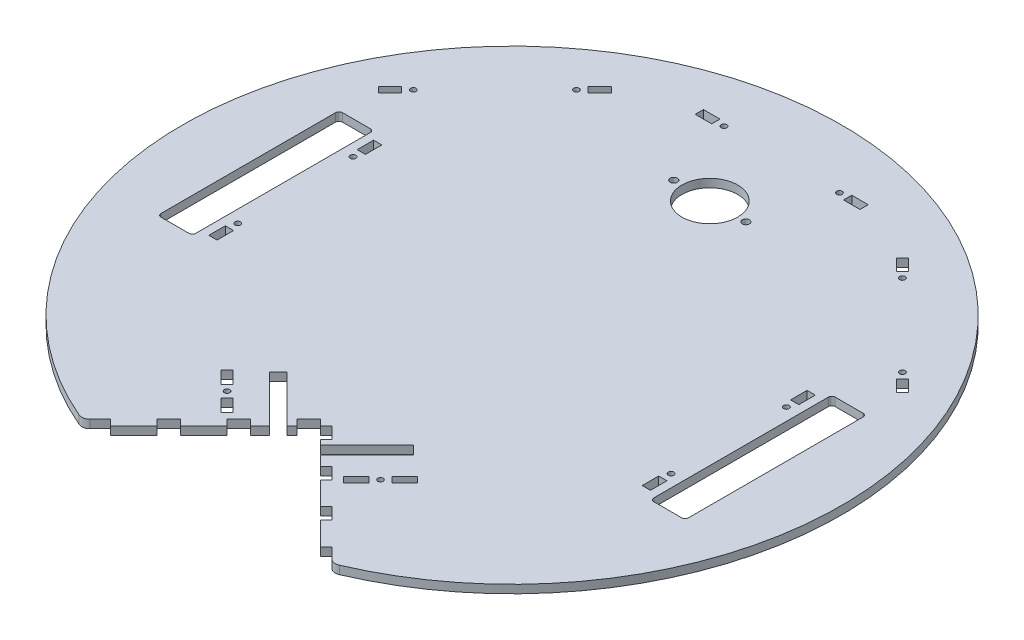
from build123d import *

# Parameters (mm, degrees)
SKETCH1_R           = 254
BOSS_EXTRUDE1_DEPTH = 6.35
CUT_EXTRUDE2_DEPTH  = 360.266367059
CUT_EXTRUDE4_DEPTH  = 360.266367059
SKETCH6_R           = 2.0955
CUT_EXTRUDE6_DEPTH  = 360.266367059
SKETCH8_R           = 2.1336
SKETCH8_W           = 6.35
SKETCH8_H           = 12.7
CUT_EXTRUDE7_DEPTH  = 360.266367059
SKETCH9_R           = 2.1336
SKETCH9_W           = 12.7
SKETCH9_H           = 6.35
CUT_EXTRUDE8_DEPTH  = 360.266367059
SKETCH10_R          = 2.1336
CUT_EXTRUDE9_DEPTH  = 360.266367059
SKETCH11_R          = 21.463
SKETCH11_R_2        = 2.778125
CUT_EXTRUDE10_DEPTH = 360.266367059
SKETCH12_W          = 25.4
SKETCH12_H          = 6.35
SKETCH12_W_2        = 12.7
CUT_EXTRUDE11_DEPTH = 6.35
FILLET1_R           = 6.35
CUT_EXTRUDE12_DEPTH = 360.266367059


with BuildPart() as part:
    # Sketch1 → Boss-Extrude1 (new body)
    with BuildSketch(Plane(origin=(0, 0, 0), x_dir=(1, 0, 0), z_dir=(0, 1, 0))):
        Circle(SKETCH1_R)
    extrude(amount=BOSS_EXTRUDE1_DEPTH)

    # Sketch2 → Cut-Extrude2 (cut, through all)
    with BuildSketch(Plane(origin=(0, 6.35, 0), x_dir=(1, 0, 0), z_dir=(0, 1, 0))):
        with BuildLine():
            Line((0, -147.792682849), (-89.802561211, -237.59524406))
            ThreePointArc((-89.802561211, -237.59524406), (0, -254), (89.802561211, -237.59524406))
            Line((89.802561211, -237.59524406), (0, -147.792682849))
        make_face()
    extrude(amount=-CUT_EXTRUDE2_DEPTH, mode=Mode.SUBTRACT)

    # Sketch4 → Cut-Extrude4 (cut, through all)
    with BuildSketch(Plane(origin=(0, 6.35, 0), x_dir=(1, 0, 0), z_dir=(0, 1, 0))):
        with BuildLine():
            Line((-200.66, 69.85), (-179.07, 69.85))
            ThreePointArc((-179.07, 69.85), (-177.273948776, 69.106051224), (-176.53, 67.31))
            Line((-176.53, 67.31), (-176.53, -67.31))
            ThreePointArc((-176.53, -67.31), (-177.273948776, -69.106051224), (-179.07, -69.85))
            Line((-179.07, -69.85), (-200.66, -69.85))
            ThreePointArc((-200.66, -69.85), (-202.456051224, -69.106051224), (-203.2, -67.31))
            Line((-203.2, -67.31), (-203.2, 67.31))
            ThreePointArc((-203.2, 67.31), (-202.456051224, 69.106051224), (-200.66, 69.85))
        make_face()
    cut_extrude4 = extrude(amount=-CUT_EXTRUDE4_DEPTH, mode=Mode.SUBTRACT)

    # Mirror2: Cut-Extrude4 across plane
    add(cut_extrude4.mirror(Plane(origin=(0, 0, 0), x_dir=(0, 0, 1), z_dir=(1, 0, 0))), mode=Mode.SUBTRACT)

    # Sketch6 → Cut-Extrude6 (cut, through all)
    with BuildSketch(Plane(origin=(0, 6.35, 0), x_dir=(1, 0, 0), z_dir=(0, 1, 0))):
        with Locations((-59.123400668, -160.51133115)):
            Circle(SKETCH6_R)
        Polygon((-61.368464698, -153.77613906), (-71.1004567, -144.044147058), (-75.59058476, -148.534275118), (-65.858592758, -158.26626712), align=None)
        Polygon((-52.388208577, -162.756395181), (-42.656216575, -172.488387182), (-47.146344636, -176.978515243), (-56.878336637, -167.246523241), align=None)
    cut_extrude6 = extrude(amount=-CUT_EXTRUDE6_DEPTH, mode=Mode.SUBTRACT)

    # Mirror5: Cut-Extrude6 across plane
    add(cut_extrude6.mirror(Plane(origin=(0, 0, 0), x_dir=(0, 0, 1), z_dir=(1, 0, 0))), mode=Mode.SUBTRACT)

    # Sketch8 → Cut-Extrude7 (cut, through all)
    with BuildSketch(Plane.XZ):
        with Locations((-167.005, -44.45)):
            Circle(SKETCH8_R)
        with Locations((-167.005, 44.45)):
            Circle(SKETCH8_R)
        with Locations((-167.005, -57.15)):
            Rectangle(SKETCH8_W, SKETCH8_H)
        with Locations((-167.005, 57.15)):
            Rectangle(SKETCH8_W, SKETCH8_H)
    cut_extrude7 = extrude(amount=-CUT_EXTRUDE7_DEPTH, mode=Mode.SUBTRACT)

    # Mirror6: Cut-Extrude7 across plane
    add(cut_extrude7.mirror(Plane(origin=(0, 0, 0), x_dir=(0, 0, 1), z_dir=(1, 0, 0))), mode=Mode.SUBTRACT)

    # Sketch9 → Cut-Extrude8 (cut, through all)
    with BuildSketch(Plane.XZ):
        with Locations((-44.45, -207.81727558)):
            Circle(SKETCH9_R)
        with Locations((44.45, -207.81727558)):
            Circle(SKETCH9_R)
        with Locations((-57.15, -207.81727558)):
            Rectangle(SKETCH9_W, SKETCH9_H)
        with Locations((57.15, -207.81727558)):
            Rectangle(SKETCH9_W, SKETCH9_H)
    extrude(amount=-CUT_EXTRUDE8_DEPTH, mode=Mode.SUBTRACT)

    # Sketch10 → Cut-Extrude9 (cut, through all)
    with BuildSketch(Plane.XZ):
        with Locations((-188.470279928, -112.368300127)):
            Circle(SKETCH10_R)
        with Locations((-125.608487081, -175.230092975)):
            Circle(SKETCH10_R)
        Polygon((-204.18572814, -101.142979976), (-195.205472019, -110.123236097), (-190.715343959, -105.633108037), (-199.69560008, -96.652851915), align=None)
        Polygon((-123.363423051, -181.965285066), (-114.38316693, -190.945541187), (-109.893038869, -186.455413126), (-118.87329499, -177.475157005), align=None)
    cut_extrude9 = extrude(amount=-CUT_EXTRUDE9_DEPTH, mode=Mode.SUBTRACT)

    # Mirror7: Cut-Extrude9 across plane
    add(cut_extrude9.mirror(Plane(origin=(0, 0, 0), x_dir=(0, 0, 1), z_dir=(1, 0, 0))), mode=Mode.SUBTRACT)

    # Sketch11 → Cut-Extrude10 (cut, through all)
    with BuildSketch(Plane(origin=(0, 6.35, 0), x_dir=(1, 0, 0), z_dir=(0, 1, 0))):
        with Locations((0, 152.4)):
            Circle(SKETCH11_R)
        with Locations((27.78125, 152.4)):
            Circle(SKETCH11_R_2)
        with Locations((-27.78125, 152.4)):
            Circle(SKETCH11_R_2)
    extrude(amount=-CUT_EXTRUDE10_DEPTH, mode=Mode.SUBTRACT)

    # Sketch12 → Cut-Extrude11 (cut)
    with BuildSketch(Plane(origin=(73.896341425, 0, 73.896341425), x_dir=(0.7071067811865489, 0, -0.7071067811865462), z_dir=(0.7071067811865462, 0, 0.7071067811865489))):
        with Locations((-231.505208253, 3.175)):
            Rectangle(SKETCH12_W, SKETCH12_H)
        with Locations((-187.055208253, 3.175)):
            Rectangle(SKETCH12_W_2, SKETCH12_H)
        with Locations((-148.955208253, 3.175)):
            Rectangle(SKETCH12_W_2, SKETCH12_H)
        with Locations((-110.855208253, 3.175)):
            Rectangle(SKETCH12_W_2, SKETCH12_H)
    cut_extrude11 = extrude(amount=-CUT_EXTRUDE11_DEPTH, mode=Mode.SUBTRACT)

    # Mirror8: Cut-Extrude11 across plane
    add(cut_extrude11.mirror(Plane(origin=(0, 0, 0), x_dir=(0, 0, 1), z_dir=(1, 0, 0))), mode=Mode.SUBTRACT)

    # Fillet1
    fillet1_edges = [part.edges().sort_by_distance(p)[0] for p in [
        (96.246367498, 3.175, 235.058794227),
        (-96.246367498, 3.175, 235.058794227),
    ]]
    fillet(fillet1_edges, radius=FILLET1_R)

    # Sketch13 → Cut-Extrude12 (cut, through all)
    with BuildSketch(Plane(origin=(0, 6.35, 0), x_dir=(1, 0, 0), z_dir=(0, 1, 0))):
        Polygon((-12.817503166, -160.610186015), (-19.541400198, -167.334083047), (-55.462424682, -131.413058563), (-48.73852765, -124.689161531), align=None)
    cut_extrude12 = extrude(amount=-CUT_EXTRUDE12_DEPTH, mode=Mode.SUBTRACT)

    # Mirror9: Cut-Extrude12 across plane
    add(cut_extrude12.mirror(Plane(origin=(0, 0, 0), x_dir=(0, 0, 1), z_dir=(1, 0, 0))), mode=Mode.SUBTRACT)


solid = part.part
